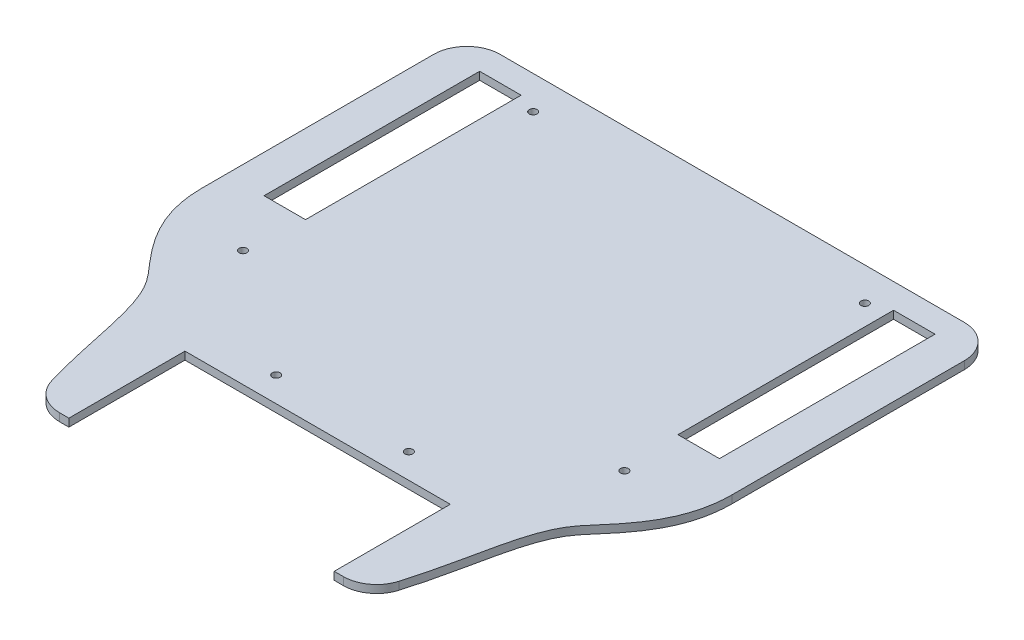
from build123d import *

# Parameters (mm, degrees)
BOSS_EXTRUDE1_DEPTH = 1.5
SKETCH3_R           = 1.5
SKETCH3_W           = 15.875
SKETCH3_H           = 82.55
CUT_EXTRUDE1_DEPTH  = 144.715413374
FILLET1_R           = 12.7


with BuildPart() as part:
    # Sketch1 → Boss-Extrude1 (new, symmetric)
    with BuildSketch(Plane(origin=(0, 0, 0), x_dir=(1, 0, 0), z_dir=(0, 1, 0))):
        with BuildLine():
            Line((-101.6, 0), (-101.6, 101.6))
            Line((-101.6, 101.6), (101.6, 101.6))
            Line((101.6, 101.6), (101.6, 0))
            add(Edge.make_bspline(
                [(101.6, 0), (101.6, -15.24), (92.836364207, -28.257655975), (72.917051275, -49.879895788), (72.621677222, -76.538397804), (63.5, -101.6)],
                knots=[0, 0, 0, 0, 0.415380003, 0.515380003, 1, 1, 1, 1], degree=3))
            Line((63.5, -101.6), (50.8, -101.6))
            Line((50.8, -101.6), (50.8, -57.15))
            Line((50.8, -57.15), (-50.8, -57.15))
            Line((-50.8, -57.15), (-50.8, -101.6))
            Line((-50.8, -101.6), (-63.5, -101.6))
            add(Edge.make_bspline(
                [(-101.6, 0), (-101.6, -15.24), (-92.836364207, -28.257655975), (-72.917051275, -49.879895788), (-72.621677222, -76.538397804), (-63.5, -101.6)],
                knots=[0, 0, 0, 0, 0.415380003, 0.515380003, 1, 1, 1, 1], degree=3))
        make_face()
    extrude(amount=BOSS_EXTRUDE1_DEPTH, both=True)

    # Sketch3 → Cut-Extrude1 (cut, through all)
    with BuildSketch(Plane(origin=(0, 1.5, 0), x_dir=(1, 0, 0), z_dir=(0, 1, 0))):
        with Locations((-63.499999999, 88.9)):
            Circle(SKETCH3_R)
        with Locations((-73.024999999, -12.7)):
            Circle(SKETCH3_R)
        with Locations((-25.399999999, -47.625)):
            Circle(SKETCH3_R)
        with Locations((25.399999999, -47.625)):
            Circle(SKETCH3_R)
        with Locations((73.024999999, -12.7)):
            Circle(SKETCH3_R)
        with Locations((63.499999999, 88.9)):
            Circle(SKETCH3_R)
        with Locations((-79.25, 50.8)):
            Rectangle(SKETCH3_W, SKETCH3_H)
        with Locations((79.25, 50.8)):
            Rectangle(SKETCH3_W, SKETCH3_H)
    extrude(amount=-CUT_EXTRUDE1_DEPTH, mode=Mode.SUBTRACT)

    # Fillet1
    fillet1_edges = [part.edges().sort_by_distance(p)[0] for p in [
        (101.6, 0, -101.6),
        (-101.6, 0, -101.6),
        (-63.5, -0.75, 101.6),
        (63.5, -0.75, 101.6),
    ]]
    fillet(fillet1_edges, radius=FILLET1_R)


solid = part.part
